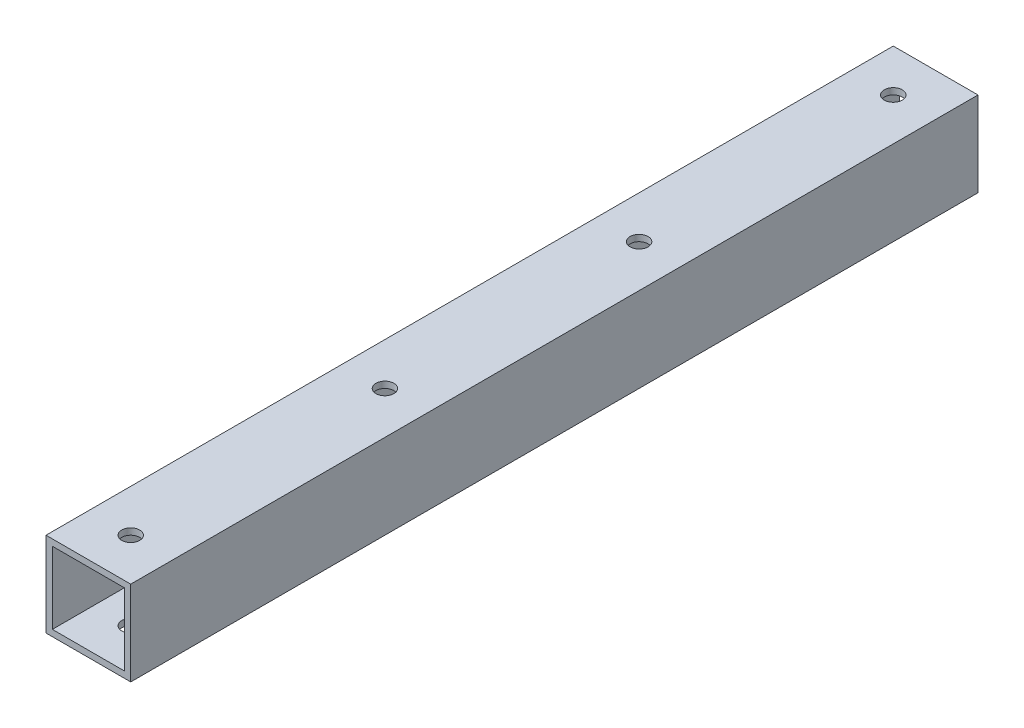
from build123d import *

# Parameters (mm, degrees)
SKETCH1_W           = 20
SKETCH1_H           = 20
SKETCH1_W_2         = 17
SKETCH1_H_2         = 17
BOSS_EXTRUDE1_DEPTH = 200
SKETCH2_R           = 2.125
CUT_EXTRUDE1_DEPTH  = 202.246117975


with BuildPart() as part:
    # Sketch1 → Boss-Extrude1 (new body)
    with BuildSketch(Plane.XY):
        Rectangle(SKETCH1_W, SKETCH1_H)
        Rectangle(SKETCH1_W_2, SKETCH1_H_2, mode=Mode.SUBTRACT)
    extrude(amount=-BOSS_EXTRUDE1_DEPTH)

    # Sketch2 → Cut-Extrude1 (cut, through all)
    with BuildSketch(Plane(origin=(0, 10, 0), x_dir=(1, 0, 0), z_dir=(0, 1, 0))):
        with Locations((0, 10)):
            Circle(SKETCH2_R)
        with Locations((0, 70)):
            Circle(SKETCH2_R)
        with Locations((0, 130)):
            Circle(SKETCH2_R)
        with Locations((0, 190)):
            Circle(SKETCH2_R)
    extrude(amount=-CUT_EXTRUDE1_DEPTH, mode=Mode.SUBTRACT)


solid = part.part
